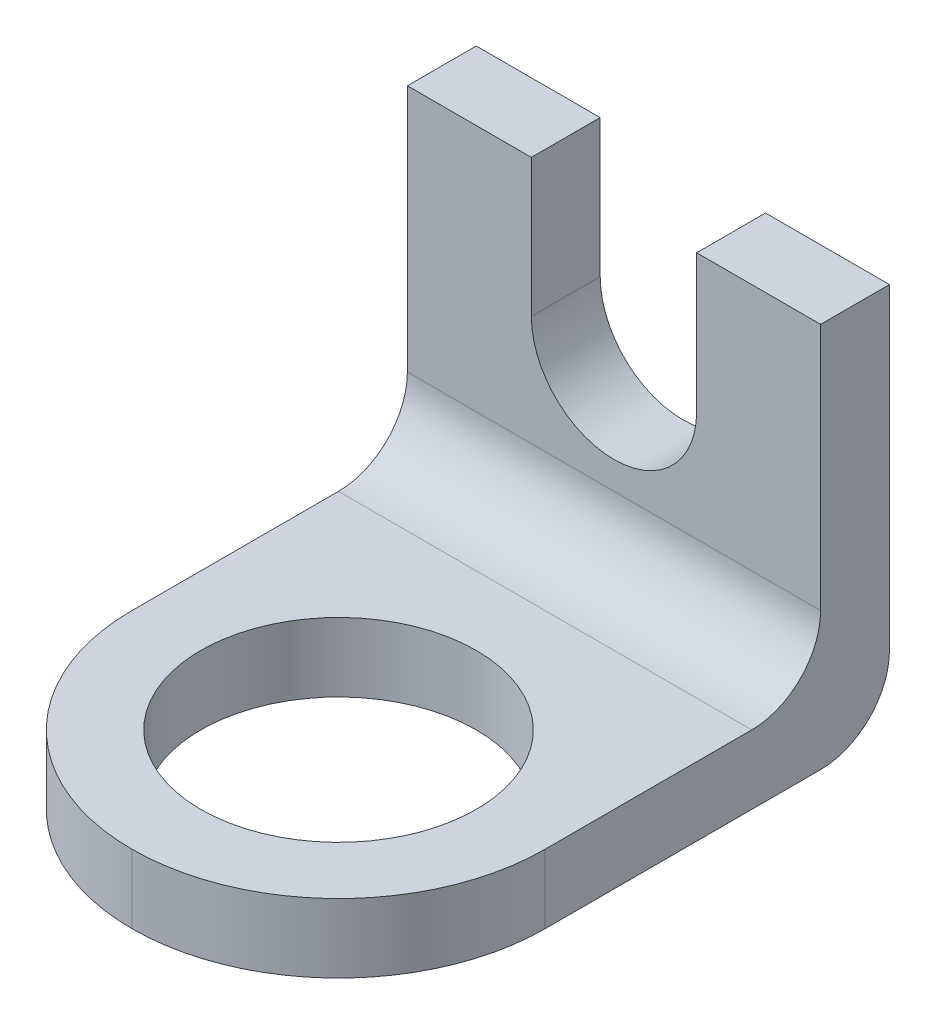
from build123d import *

# Parameters (mm, degrees)
SKETCH_1_W          = 30
SKETCH_1_H          = 28
EXTRUDE_1_DEPTH     = 5
CUT_EXTRUDE_1_DEPTH = 22.118712082
SKETCH_3_W          = 30
SKETCH_3_H          = 5
EXTRUDE_2_DEPTH     = 35
FILLET_1_R          = 5
FILLET_2_R          = 15
FILLET_3_R          = 15
SKETCH_4_R          = 10
CUT_EXTRUDE_2_DEPTH = 49.518037883
FILLET_5_R          = 5


with BuildPart() as part:
    # Эскиз1 → Бобышка-Вытянуть1 (new body)
    with BuildSketch(Plane.XY):
        Rectangle(SKETCH_1_W, SKETCH_1_H)
    extrude(amount=EXTRUDE_1_DEPTH)

    # Эскиз2 → Вырез-Вытянуть1 (cut, through all)
    with BuildSketch(Plane.XY.offset(5)):
        with BuildLine():
            Line((-6, 14), (6, 14))
            Line((6, 14), (6, 4))
            ThreePointArc((6, 4), (0, -2), (-6, 4))
            Line((-6, 4), (-6, 14))
        make_face()
    extrude(amount=-CUT_EXTRUDE_1_DEPTH, mode=Mode.SUBTRACT)

    # Эскиз3 → Бобышка-Вытянуть2 (add)
    with BuildSketch(Plane.XY.offset(5)):
        with Locations((0, -11.5)):
            Rectangle(SKETCH_3_W, SKETCH_3_H)
    extrude(amount=EXTRUDE_2_DEPTH)

    # Скругление1
    fillet_1_edges = [part.edges().sort_by_distance(p)[0] for p in [
        (0, -14, 0),
    ]]
    fillet(fillet_1_edges, radius=FILLET_1_R)

    # Скругление2
    fillet_2_edges = [part.edges().sort_by_distance(p)[0] for p in [
        (15, -11.5, 40),
    ]]
    fillet(fillet_2_edges, radius=FILLET_2_R)

    # Скругление3
    fillet_3_edges = [part.edges().sort_by_distance(p)[0] for p in [
        (-15, -11.5, 40),
    ]]
    fillet(fillet_3_edges, radius=FILLET_3_R - 0.0001)  # a hair under: the kernel refuses the full size

    # Эскиз4 → Вырез-Вытянуть2 (cut, through all)
    with BuildSketch(Plane(origin=(0, -9, 0), x_dir=(1, 0, 0), z_dir=(0, 1, 0))):
        with Locations(Location((0, -25, 0), (0, 0, 270))):
            Circle(SKETCH_4_R)
    extrude(amount=-CUT_EXTRUDE_2_DEPTH, mode=Mode.SUBTRACT)

    # Скругление5
    fillet_5_edges = [part.edges().sort_by_distance(p)[0] for p in [
        (0, -9, 5),
    ]]
    fillet(fillet_5_edges, radius=FILLET_5_R)


solid = part.part
